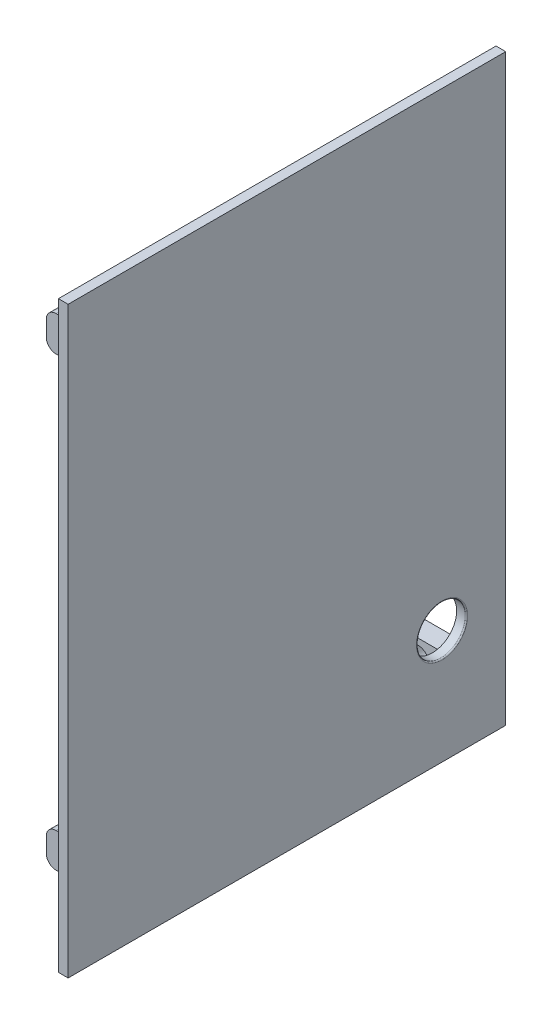
from build123d import *

# Parameters (mm, degrees)
SKETCH3_W               = 89.999999927
SKETCH3_H               = 120.000002513
BOSS_EXTRUDE1_DEPTH     = 2
SKETCH4_R               = 5
CUT_EXTRUDE1_DEPTH      = 152.605067169
FILLET1_R               = 0.25
SKETCH5_W               = 4
SKETCH5_H               = 7.072983346
SKETCH5_H_2             = 7.2
BOSS_EXTRUDE2_DEPTH     = 10
CUT_EXTRUDE2_DEPTH      = 327.807943418
CUT_EXTRUDE2_DEPTH_BACK = 327.807943418
SKETCH6_R               = 2.25
FILLET2_R               = 2


with BuildPart() as part:
    # Sketch3 → Boss-Extrude1 (new body)
    with BuildSketch(Plane(origin=(282.530741059, 0, 0), x_dir=(0, -6.071029670218199e-10, -1.0), z_dir=(1, 0, 0))):
        with Locations((13.762804665, 79.739145615)):
            Rectangle(SKETCH3_W, SKETCH3_H)
    extrude(amount=BOSS_EXTRUDE1_DEPTH)

    # Sketch4 → Cut-Extrude1 (cut, through all)
    with BuildSketch(Plane(origin=(284.530741059, 0, 0), x_dir=(0, 0, -1), z_dir=(1, 0, 0))):
        with Locations((45.667804714, 43.189146835)):
            Circle(SKETCH4_R)
    extrude(amount=-CUT_EXTRUDE1_DEPTH, mode=Mode.SUBTRACT)

    # Fillet1
    fillet1_edges = [part.edges().sort_by_distance(p)[0] for p in [
        (284.530741059, 43.189146835, -40.667804714),
    ]]
    fillet(fillet1_edges, radius=FILLET1_R)

    # Sketch5 → Boss-Extrude2 (add)
    with BuildSketch(Plane.ZY.offset(-282.530741059)):
        with Locations((-49.752804714, 33.739146835)):
            Rectangle(SKETCH5_W, SKETCH5_H)
        with Locations((-50.252804714, 125.739146835)):
            Rectangle(SKETCH5_W, SKETCH5_H_2)
        with Locations((21.737195286, 33.739146835)):
            Rectangle(SKETCH5_W, SKETCH5_H)
        with Locations((21.737195286, 125.739146835)):
            Rectangle(SKETCH5_W, SKETCH5_H_2)
    extrude(amount=BOSS_EXTRUDE2_DEPTH)

    # Sketch6 → Cut-Extrude2 (cut, two sides: drawn at the far end of the back side and taken through both)
    with BuildSketch(Plane.XY.offset(-48.252804714).offset(-CUT_EXTRUDE2_DEPTH_BACK)):
        with Locations((277.530741059, 33.739146835)):
            Circle(SKETCH6_R)
        with Locations((277.530741059, 125.739146835)):
            Circle(SKETCH6_R)
    extrude(amount=CUT_EXTRUDE2_DEPTH + CUT_EXTRUDE2_DEPTH_BACK, mode=Mode.SUBTRACT)

    # Fillet2
    fillet2_edges = [part.edges().sort_by_distance(p)[0] for p in [
        (272.530741059, 129.339146835, -50.252804714),
        (272.530741059, 122.139146835, -50.252804714),
        (272.530741059, 129.339146835, 21.737195286),
        (272.530741059, 122.139146835, 21.737195286),
        (272.530741059, 37.275638508, 21.737195286),
        (272.530741059, 30.202655162, 21.737195286),
        (272.530741059, 37.275638508, -49.752804714),
        (272.530741059, 30.202655162, -49.752804714),
    ]]
    fillet(fillet2_edges, radius=FILLET2_R)


solid = part.part
